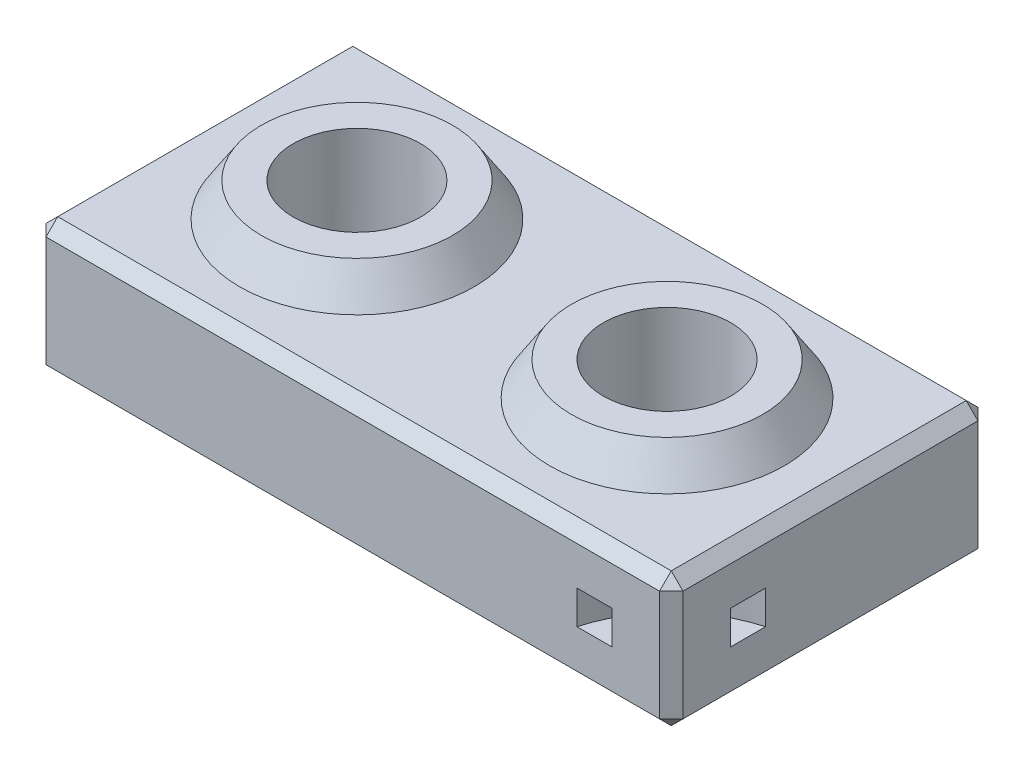
from build123d import *

# Parameters (mm, degrees)
CROQUIS1_W              = 38
CROQUIS1_H              = 19
SALIENTE_EXTRUIR1_DEPTH = 8
CROQUIS2_R              = 5
SALIENTE_EXTRUIR2_DEPTH = 2
CROQUIS3_R              = 3.8
CORTAR_EXTRUIR1_DEPTH   = 24.478713764
CHAFL_N2_SIZE           = 0.7
CROQUIS4_R              = 5.25
CORTAR_EXTRUIR2_DEPTH   = 2.2
CHAFL_N1_SIZE           = 2
CHAFL_N1_SIZE_2         = 3.079729928
CORTAR_EXTRUIR3_START   = -3
CROQUIS6_R              = 8.19764283
CROQUIS6_R_2            = 6.19764283
CORTAR_EXTRUIR3_DEPTH   = 2


with BuildPart() as part:
    # Croquis1 → Saliente-Extruir1 (new body)
    with BuildSketch(Plane(origin=(0, 0, 0), x_dir=(1, 0, 0), z_dir=(0, 1, 0))):
        Rectangle(CROQUIS1_W, CROQUIS1_H)
    extrude(amount=SALIENTE_EXTRUIR1_DEPTH)

    # Croquis2 → Saliente-Extruir2 (add)
    with BuildSketch(Plane(origin=(0, 8, 0), x_dir=(1, 0, 0), z_dir=(0, 1, 0))):
        with Locations(Location((-9.25, 0, 0), (0, 0, 270))):
            Circle(CROQUIS2_R)
        with Locations(Location((9.25, 0, 0), (0, 0, 270))):
            Circle(CROQUIS2_R)
    extrude(amount=SALIENTE_EXTRUIR2_DEPTH)

    # Croquis3 → Cortar-Extruir1 (cut, through all)
    with BuildSketch(Plane(origin=(0, 10, 0), x_dir=(1, 0, 0), z_dir=(0, 1, 0))):
        with Locations(Location((9.25, 0, 0), (0, 0, 270))):
            Circle(CROQUIS3_R)
        with Locations(Location((-9.25, 0, 0), (0, 0, 270))):
            Circle(CROQUIS3_R)
    extrude(amount=-CORTAR_EXTRUIR1_DEPTH, mode=Mode.SUBTRACT)

    # Chaflán2
    chafl_n2_edges = [part.edges().sort_by_distance(p)[0] for p in [
        (-19, 8, 0),
        (0, 8, 9.5),
        (19, 8, 0),
        (0, 0, 9.5),
        (-19, 0, 0),
        (0, 0, -9.5),
        (19, 0, 0),
        (0, 8, -9.5),
        (19, 4, 9.5),
        (-19, 4, 9.5),
        (-19, 4, -9.5),
        (19, 4, -9.5),
    ]]
    chamfer(chafl_n2_edges, length=CHAFL_N2_SIZE)

    # Croquis4 → Cortar-Extruir2 (cut)
    with BuildSketch(Plane.XZ):
        with Locations(Location((9.25, 0, 0), (0, 0, 270))):
            Circle(CROQUIS4_R)
        with Locations(Location((-9.25, 0, 0), (0, 0, 270))):
            Circle(CROQUIS4_R)
    extrude(amount=-CORTAR_EXTRUIR2_DEPTH, mode=Mode.SUBTRACT)

    # Chaflán1
    # the kernel refuses this chamfer: 3.079729928, 2 mm, written as the material it adds along each edge
    with BuildSketch(Plane(origin=(9.25, 8, 0), x_dir=(0, 0, 1), z_dir=(-1, 0, 0))) as chafl_n1_piece_1_section:
        Polygon((5 + CHAFL_N1_SIZE, 0), (5, CHAFL_N1_SIZE_2), (5, 0), align=None)
    chafl_n1_piece_1 = revolve(axis=Axis((9.25, 8, 0), (0, 1, 0)), mode=Mode.PRIVATE)
    chafl_n1_piece_1 = split(chafl_n1_piece_1, bisect_by=Plane(origin=(9.25, 10, -6.344305077), z_dir=(0, -1, 0)), keep=Keep.TOP, mode=Mode.PRIVATE)
    add(chafl_n1_piece_1)
    with BuildSketch(Plane(origin=(-9.25, 8, 0), x_dir=(0, 0, 1), z_dir=(-1, 0, 0))) as chafl_n1_piece_2_section:
        Polygon((5 + CHAFL_N1_SIZE, 0), (5, CHAFL_N1_SIZE_2), (5, 0), align=None)
    chafl_n1_piece_2 = revolve(axis=Axis((-9.25, 8, 0), (0, 1, 0)), mode=Mode.PRIVATE)
    chafl_n1_piece_2 = split(chafl_n1_piece_2, bisect_by=Plane(origin=(-9.25, 10, -6.344305078), z_dir=(0, -1, 0)), keep=Keep.TOP, mode=Mode.PRIVATE)
    add(chafl_n1_piece_2)
    # the kernel refuses this chamfer: 3.079729928, 2 mm, written as the material it takes off along each edge
    with BuildSketch(Plane(origin=(-9.25, 0, 0), x_dir=(0, 0, -1), z_dir=(-1, 0, 0))) as chafl_n1_2_piece_1_section:
        Polygon((5.25 + CHAFL_N1_SIZE, 0), (5.25, -CHAFL_N1_SIZE_2), (5.25, 0), align=None)
    chafl_n1_2_piece_1 = revolve(axis=Axis((-9.25, 0, 0), (0, -1, 0)), mode=Mode.PRIVATE)
    chafl_n1_2_piece_1 = split(chafl_n1_2_piece_1, bisect_by=Plane(origin=(-9.25, 2.2, 6.528205243), z_dir=(0, -1, 0)), keep=Keep.TOP, mode=Mode.PRIVATE)
    add(chafl_n1_2_piece_1, mode=Mode.SUBTRACT)
    with BuildSketch(Plane(origin=(9.25, 0, 0), x_dir=(0, 0, -1), z_dir=(-1, 0, 0))) as chafl_n1_2_piece_2_section:
        Polygon((5.25 + CHAFL_N1_SIZE, 0), (5.25, -CHAFL_N1_SIZE_2), (5.25, 0), align=None)
    chafl_n1_2_piece_2 = revolve(axis=Axis((9.25, 0, 0), (0, -1, 0)), mode=Mode.PRIVATE)
    chafl_n1_2_piece_2 = split(chafl_n1_2_piece_2, bisect_by=Plane(origin=(9.25, 2.2, 6.528205242), z_dir=(0, -1, 0)), keep=Keep.TOP, mode=Mode.PRIVATE)
    add(chafl_n1_2_piece_2, mode=Mode.SUBTRACT)

    # Croquis6 → Cortar-Extruir3 (cut)
    with BuildSketch(Plane(origin=(0, 8, 0), x_dir=(1, 0, 0), z_dir=(0, 1, 0)).offset(CORTAR_EXTRUIR3_START)):
        with Locations((21.250343834, -11.750343834)):
            Circle(CROQUIS6_R)
        with Locations((21.250343834, -11.750343834)):
            Circle(CROQUIS6_R_2, mode=Mode.SUBTRACT)
    extrude(amount=-CORTAR_EXTRUIR3_DEPTH, mode=Mode.SUBTRACT)


solid = part.part
